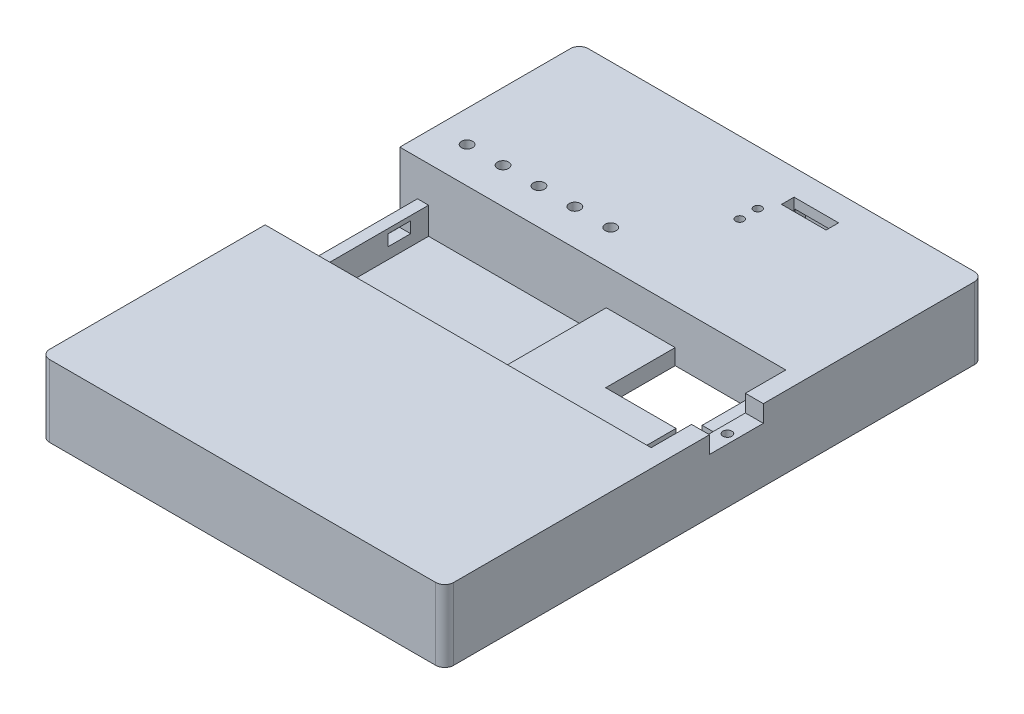
from build123d import *

# Parameters (mm, degrees)
SKETCH1_W            = 90
SKETCH1_H            = 120
BOSS_EXTRUDE1_DEPTH  = 15
SKETCH2_W            = 46
SKETCH2_H            = 30
CUT_EXTRUDE1_DEPTH   = 12
SKETCH3_W            = 44
SKETCH3_H            = 30
CUT_EXTRUDE2_DEPTH   = 8
SHELL1_START         = -47.6
SHELL1_OUTLINE_W     = 85.2
SHELL1_OUTLINE_H     = 13
SHELL1_DEPTH         = 45.2
SHELL1_START_2       = -117.6
SHELL1_2_OUTLINE_W   = 85.2
SHELL1_2_OUTLINE_H   = 5
SHELL1_2_DEPTH       = 35.2
SKETCH7_W            = 39
SKETCH7_H            = 34.8
CUT_EXTRUDE6_DEPTH   = 5
SKETCH11_W           = 42.056152249
SKETCH11_H           = 30
CUT_EXTRUDE9_DEPTH   = 2
CUT_EXTRUDE7_DEPTH   = 10
CUT_EXTRUDE10_DEPTH  = 3
SKETCH14_W           = 90
SKETCH14_H           = 120
SKETCH14_W_2         = 88.2
SKETCH14_H_2         = 118.2
BOSS_EXTRUDE2_DEPTH  = 1
SKETCH22_W           = 4
SKETCH22_H           = 30
BOSS_EXTRUDE6_DEPTH  = 8
SKETCH26_W           = 4
SKETCH26_H           = 12
CUT_EXTRUDE20_DEPTH  = 3.8
SKETCH27_R           = 1
CUT_EXTRUDE21_DEPTH  = 3
BOSS_EXTRUDE9_DEPTH  = 1.5
SKETCH40_R           = 3.5
CUT_EXTRUDE24_DEPTH  = 5
FILLET1_R            = 3
SKETCH44_W           = 85.2
SKETCH44_H           = 35.2
CUT_EXTRUDE25_DEPTH  = 7.8
SKETCH46_W           = 4.8
SKETCH46_H           = 15.6
BOSS_EXTRUDE15_DEPTH = 12.5
SKETCH6_R            = 0.9
CUT_EXTRUDE26_DEPTH  = 29.4
SKETCH47_W           = 33.8
SKETCH47_H           = 8
SKETCH47_W_2         = 8
BOSS_EXTRUDE16_DEPTH = 12.5
SKETCH49_W           = 41.022368698
SKETCH49_H           = 10
SKETCH49_W_2         = 8
BOSS_EXTRUDE17_DEPTH = 12.7
SKETCH50_W           = 22
SKETCH50_H           = 7
SKETCH50_W_2         = 20
SKETCH50_H_2         = 9
CUT_EXTRUDE28_DEPTH  = 12.5
FILLET3_R            = 5
FILLET4_R            = 2
SKETCH51_R           = 2.5
CUT_EXTRUDE29_DEPTH  = 6
CUT_EXTRUDE30_DEPTH  = 3
SKETCH52_R           = 1.5
CUT_EXTRUDE31_DEPTH  = 3
SKETCH54_W           = 2.470433815
SKETCH54_H           = 30
BOSS_EXTRUDE18_DEPTH = 6
SKETCH55_W           = 5
SKETCH55_H           = 2.5
CUT_EXTRUDE32_DEPTH  = 3
FILLET5_R            = 1
SKETCH56_R           = 1.25
CUT_EXTRUDE33_DEPTH  = 3
SKETCH57_W           = 2.5
SKETCH57_H           = 8
SKETCH57_W_2         = 4
BOSS_EXTRUDE19_DEPTH = 8
SKETCH58_W           = 1.5
SKETCH58_H           = 2
SKETCH58_W_2         = 2
CUT_EXTRUDE34_DEPTH  = 10
SKETCH59_W           = 9.920545957
SKETCH59_H           = 2.790153551
CUT_EXTRUDE35_DEPTH  = 10


# Read off the part's stored shape, not the designer's step: Shell1
with BuildPart() as part:
    # Sketch1 → Boss-Extrude1 (new body)
    with BuildSketch(Plane(origin=(0, 0, 0), x_dir=(1, 0, 0), z_dir=(0, 1, 0))):
        with Locations((45, 60)):
            Rectangle(SKETCH1_W, SKETCH1_H)
    extrude(amount=BOSS_EXTRUDE1_DEPTH)

    # Sketch2 → Cut-Extrude1 (cut)
    with BuildSketch(Plane(origin=(0, 15, 0), x_dir=(1, 0, 0), z_dir=(0, 1, 0))):
        with Locations((23, 65)):
            Rectangle(SKETCH2_W, SKETCH2_H)
    extrude(amount=-CUT_EXTRUDE1_DEPTH, mode=Mode.SUBTRACT)

    # Sketch3 → Cut-Extrude2 (cut)
    with BuildSketch(Plane(origin=(0, 15, 0), x_dir=(1, 0, 0), z_dir=(0, 1, 0))):
        with Locations((68, 65)):
            Rectangle(SKETCH3_W, SKETCH3_H)
    extrude(amount=-CUT_EXTRUDE2_DEPTH, mode=Mode.SUBTRACT)

    # Shell1 outline → Shell1 (cut)
    with BuildSketch(Plane.XY.offset(SHELL1_START)):
        with Locations((45, 6.5)):
            Rectangle(SHELL1_OUTLINE_W, SHELL1_OUTLINE_H)
    extrude(amount=SHELL1_DEPTH, mode=Mode.SUBTRACT)

    # Shell1 2 outline → Shell1 2 (cut)
    with BuildSketch(Plane.XY.offset(SHELL1_START_2)):
        with Locations((45, 2.5)):
            Rectangle(SHELL1_2_OUTLINE_W, SHELL1_2_OUTLINE_H)
    extrude(amount=SHELL1_2_DEPTH, mode=Mode.SUBTRACT)

    # Sketch7 → Cut-Extrude6 (cut)
    with BuildSketch(Plane.XZ):
        with Locations((68.1, -65)):
            Rectangle(SKETCH7_W, SKETCH7_H)
    extrude(amount=-CUT_EXTRUDE6_DEPTH, mode=Mode.SUBTRACT)

    # Sketch11 → Cut-Extrude9 (cut)
    with BuildSketch(Plane(origin=(0, 3, 0), x_dir=(1, 0, 0), z_dir=(0, 1, 0))):
        with Locations((24.971923875, 65)):
            Rectangle(SKETCH11_W, SKETCH11_H)
    extrude(amount=-CUT_EXTRUDE9_DEPTH, mode=Mode.SUBTRACT)

    # Sketch8 → Cut-Extrude7 (cut)
    with BuildSketch(Plane.ZY.offset(-46)):
        Polygon((-63, 1), (-63, 2.5), (-75, 2.5), (-75, 4.5), (-63, 4.5), (-63, 6), (-52, 6), (-52, 4.5), (-52, 1), align=None)
    extrude(amount=-CUT_EXTRUDE7_DEPTH, mode=Mode.SUBTRACT)

    # Sketch12 → Cut-Extrude10 (cut)
    with BuildSketch(Plane(origin=(0, 7, 0), x_dir=(1, 0, 0), z_dir=(0, 1, 0))):
        Polygon((79.361885724, 68), (79.361885724, 80), (61.361885724, 80), (61.361885724, 64.5), (77.04695331, 64.5), (77.04695331, 51), (85.714801791, 51), (85.714801791, 68), align=None)
    extrude(amount=-CUT_EXTRUDE10_DEPTH, mode=Mode.SUBTRACT)

    # Sketch14 → Boss-Extrude2 (add)
    with BuildSketch(Plane.XZ):
        with Locations((45, -60)):
            Rectangle(SKETCH14_W, SKETCH14_H)
        with Locations((45, -60)):
            Rectangle(SKETCH14_W_2, SKETCH14_H_2, mode=Mode.SUBTRACT)
    extrude(amount=BOSS_EXTRUDE2_DEPTH)

    # Sketch22 → Boss-Extrude6 (add)
    with BuildSketch(Plane(origin=(0, 7, 0), x_dir=(1, 0, 0), z_dir=(0, 1, 0))):
        with Locations((88, 65)):
            Rectangle(SKETCH22_W, SKETCH22_H)
    extrude(amount=BOSS_EXTRUDE6_DEPTH)

    # Sketch26 → Cut-Extrude20 (cut)
    with BuildSketch(Plane(origin=(0, 15, 0), x_dir=(1, 0, 0), z_dir=(0, 1, 0))):
        with Locations((88, 65)):
            Rectangle(SKETCH26_W, SKETCH26_H)
    extrude(amount=-CUT_EXTRUDE20_DEPTH, mode=Mode.SUBTRACT)

    # Sketch27 → Cut-Extrude21 (cut)
    with BuildSketch(Plane(origin=(0, 11.2, 0), x_dir=(1, 0, 0), z_dir=(0, 1, 0))):
        with Locations(Location((88, 65, 0), (0, 0, 270))):
            Circle(SKETCH27_R)
    extrude(amount=-CUT_EXTRUDE21_DEPTH, mode=Mode.SUBTRACT)

    # Sketch36 → Boss-Extrude9 (add)
    with BuildSketch(Plane.XZ.offset(-5)):
        Polygon((77.04695331, -63.5), (60.361885724, -63.5), (60.361885724, -81), (80.361885724, -81), (80.361885724, -68), (79.361885724, -68), (79.361885724, -80), (61.361885724, -80), (61.361885724, -64.5), (77.04695331, -64.5), align=None)
    extrude(amount=BOSS_EXTRUDE9_DEPTH)

    # Sketch40 → Cut-Extrude24 (cut)
    with BuildSketch(Plane.ZY):
        with Locations((-105, 7)):
            Circle(SKETCH40_R)
    extrude(amount=-CUT_EXTRUDE24_DEPTH, mode=Mode.SUBTRACT)

    # Fillet1
    fillet1_edges = [part.edges().sort_by_distance(p)[0] for p in [
        (68.1, 5, -47.6),
    ]]
    fillet(fillet1_edges, radius=FILLET1_R)

    # Sketch44 → Cut-Extrude25 (cut)
    with BuildSketch(Plane.XZ.offset(-5)):
        with Locations((45, -100)):
            Rectangle(SKETCH44_W, SKETCH44_H)
    extrude(amount=-CUT_EXTRUDE25_DEPTH, mode=Mode.SUBTRACT)

    # Sketch46 → Boss-Extrude15 (add)
    with BuildSketch(Plane.XZ.offset(-12.8)):
        with Locations((51.4, -109.8)):
            Rectangle(SKETCH46_W, SKETCH46_H)
    extrude(amount=BOSS_EXTRUDE15_DEPTH)

    # Sketch6 → Cut-Extrude26 (cut)
    with BuildSketch(Plane(origin=(0, 15, 0), x_dir=(1, 0, 0), z_dir=(0, 1, 0))):
        with Locations(Location((51.75, 108, 0), (0, 0, 270))):
            Circle(SKETCH6_R)
        with Locations(Location((51.75, 104, 0), (0, 0, 270))):
            Circle(SKETCH6_R)
    extrude(amount=-CUT_EXTRUDE26_DEPTH, mode=Mode.SUBTRACT)

    # Sketch47 → Boss-Extrude16 (add)
    with BuildSketch(Plane.XZ.offset(-12.8)):
        with Locations((70.7, -113.6)):
            Rectangle(SKETCH47_W, SKETCH47_H)
        with Locations((6.4, -113.6)):
            Rectangle(SKETCH47_W_2, SKETCH47_H)
    extrude(amount=BOSS_EXTRUDE16_DEPTH)

    # Sketch49 → Boss-Extrude17 (add)
    with BuildSketch(Plane.XZ.offset(-13)):
        with Locations((67.088815651, -7.4)):
            Rectangle(SKETCH49_W, SKETCH49_H)
        with Locations((6.4, -7.4)):
            Rectangle(SKETCH49_W_2, SKETCH49_H)
    extrude(amount=BOSS_EXTRUDE17_DEPTH)

    # Sketch50 → Cut-Extrude28 (cut)
    with BuildSketch(Plane.XZ.offset(-0.3)):
        with Locations((64.8, -113.1)):
            Rectangle(SKETCH50_W, SKETCH50_H)
        with Locations((64.939802008, -7.9)):
            Rectangle(SKETCH50_W_2, SKETCH50_H_2)
    extrude(amount=-CUT_EXTRUDE28_DEPTH, mode=Mode.SUBTRACT)

    # Fillet3
    fillet3_edges = [part.edges().sort_by_distance(p)[0] for p in [
        (10.4, 6.55, -109.6),
        (10.4, 6.65, -12.4),
        (74.939802008, 6.55, -12.4),
    ]]
    fillet(fillet3_edges, radius=FILLET3_R)

    # Fillet4
    fillet4_edges = [part.edges().sort_by_distance(p)[0] for p in [
        (0, 7, -120),
        (90, 7, -120),
        (90, 7, 0),
        (0, 7, 0),
    ]]
    fillet(fillet4_edges, radius=FILLET4_R)

    # Sketch51 → Cut-Extrude29 (cut)
    with BuildSketch(Plane.XZ.offset(-0.3)):
        with Locations(Location((84.5, -114.5, 0), (0, 0, 270))):
            Circle(SKETCH51_R)
        with Locations(Location((84.5, -5.5, 0), (0, 0, 270))):
            Circle(SKETCH51_R)
        with Locations(Location((5.5, -5.5, 0), (0, 0, 270))):
            Circle(SKETCH51_R)
        with Locations(Location((5.5, -114.5, 0), (0, 0, 270))):
            Circle(SKETCH51_R)
    extrude(amount=-CUT_EXTRUDE29_DEPTH, mode=Mode.SUBTRACT)

    # Sketch53 → Cut-Extrude30 (cut)
    with BuildSketch(Plane.XZ.offset(-0.3)):
        Polygon((53.8, -102), (49, -102), (49, -110.656453849), (53.787002796, -110.656453849), align=None)
    extrude(amount=-CUT_EXTRUDE30_DEPTH, mode=Mode.SUBTRACT)

    # Sketch52 → Cut-Extrude31 (cut)
    with BuildSketch(Plane.XZ.offset(-0.3)):
        with Locations(Location((51.19, -6.828671793, 0), (0, 0, 270))):
            Circle(SKETCH52_R)
        with Locations(Location((78.9, -112.408671793, 0), (0, 0, 270))):
            Circle(SKETCH52_R)
    extrude(amount=-CUT_EXTRUDE31_DEPTH, mode=Mode.SUBTRACT)

    # Sketch54 → Boss-Extrude18 (add)
    with BuildSketch(Plane(origin=(0, 1, 0), x_dir=(1, 0, 0), z_dir=(0, 1, 0))):
        with Locations((5.179064659, 65)):
            Rectangle(SKETCH54_W, SKETCH54_H)
    extrude(amount=BOSS_EXTRUDE18_DEPTH)

    # Sketch55 → Cut-Extrude32 (cut)
    with BuildSketch(Plane.ZY.offset(-3.943847751)):
        with Locations((-73.5, 4.75)):
            Rectangle(SKETCH55_W, SKETCH55_H)
        with Locations((-56.5, 4.75)):
            Rectangle(SKETCH55_W, SKETCH55_H)
    extrude(amount=-CUT_EXTRUDE32_DEPTH, mode=Mode.SUBTRACT)

    # Fillet5
    fillet5_edges = [part.edges().sort_by_distance(p)[0] for p in [
        (25.5, 0, -82.4),
        (25.5, 0, -47.6),
    ]]
    fillet(fillet5_edges, radius=FILLET5_R)

    # Sketch56 → Cut-Extrude33 (cut)
    with BuildSketch(Plane(origin=(0, 15, 0), x_dir=(1, 0, 0), z_dir=(0, 1, 0))):
        with Locations(Location((7, 88, 0), (0, 0, 270))):
            Circle(SKETCH56_R)
        with Locations(Location((15, 88, 0), (0, 0, 270))):
            Circle(SKETCH56_R)
        with Locations(Location((23, 88, 0), (0, 0, 270))):
            Circle(SKETCH56_R)
        with Locations(Location((31, 88, 0), (0, 0, 270))):
            Circle(SKETCH56_R)
        with Locations(Location((39, 88, 0), (0, 0, 270))):
            Circle(SKETCH56_R)
    extrude(amount=-CUT_EXTRUDE33_DEPTH, mode=Mode.SUBTRACT)

    # Sketch57 → Boss-Extrude19 (add)
    with BuildSketch(Plane.XZ.offset(-12.8)):
        with Locations((3.65, -88.4)):
            Rectangle(SKETCH57_W, SKETCH57_H)
        with Locations((45.9, -88.4)):
            Rectangle(SKETCH57_W_2, SKETCH57_H)
    extrude(amount=BOSS_EXTRUDE19_DEPTH)

    # Sketch58 → Cut-Extrude34 (cut)
    with BuildSketch(Plane(origin=(0, 0, -92.4), x_dir=(-1, 0, 0), z_dir=(0, 0, -1))):
        with Locations((-4.15, 7.3)):
            Rectangle(SKETCH58_W, SKETCH58_H)
        with Locations((-44.9, 7.3)):
            Rectangle(SKETCH58_W_2, SKETCH58_H)
    extrude(amount=-CUT_EXTRUDE34_DEPTH, mode=Mode.SUBTRACT)

    # Sketch59 → Cut-Extrude35 (cut)
    with BuildSketch(Plane(origin=(0, 15, 0), x_dir=(1, 0, 0), z_dir=(0, 1, 0))):
        with Locations((58.533039989, 112.870908725)):
            Rectangle(SKETCH59_W, SKETCH59_H)
    extrude(amount=-CUT_EXTRUDE35_DEPTH, mode=Mode.SUBTRACT)


solid = part.part
